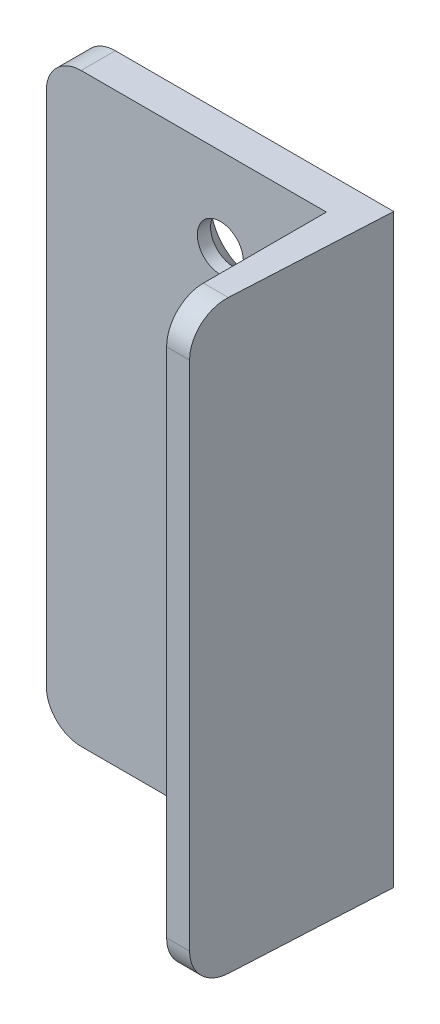
from build123d import *

# Parameters (mm, degrees)
BOSS_EXTRUDE1_DEPTH                            = 4.9
SKETCH2_W                                      = 4.75
SKETCH2_H                                      = 83.9
BOSS_EXTRUDE2_DEPTH                            = 22.9
CUT_EXTRUDE1_START                             = -4.75
CUT_EXTRUDE1_DEPTH                             = 4.75
CSK_FOR_M6_FLAT_HEAD_MACHINE_SCREW1_AT_2_COUNT = 2
CSK_FOR_M6_FLAT_HEAD_MACHINE_SCREW1_AT_2_PITCH = 59.791303716
SKETCH8_W                                      = 41.834673512
SKETCH8_H                                      = 83.9
CUT_REVOLVE4_ANGLE                             = 3


# Read off the part's stored shape, not the designer's step: Cut-Extrude1
with BuildPart() as part:
    # Sketch1 → Boss-Extrude1 (new body)
    with BuildSketch(Plane.XY):
        with BuildLine():
            Line((-17.45, -41.95), (22.45, -41.95))
            Line((22.45, -41.95), (22.45, 41.95))
            Line((22.45, 41.95), (-17.45, 41.95))
            ThreePointArc((-17.45, 41.95), (-20.985533906, 40.485533906), (-22.45, 36.95))
            Line((-22.45, 36.95), (-22.45, -36.95))
            ThreePointArc((-22.45, -36.95), (-20.985533906, -40.485533906), (-17.45, -41.95))
        make_face()
    extrude(amount=BOSS_EXTRUDE1_DEPTH)

    # Sketch2 → Boss-Extrude2 (add)
    with BuildSketch(Plane.XY.offset(4.9)):
        with Locations((20.075, 0)):
            Rectangle(SKETCH2_W, SKETCH2_H)
    extrude(amount=BOSS_EXTRUDE2_DEPTH)

    # Cut-Extrude1 outline → Cut-Extrude1 (cut)
    with BuildSketch(Plane(origin=(22.45, 0, 0), x_dir=(0, 0, -1), z_dir=(1, 0, 0)).offset(CUT_EXTRUDE1_START)):
        with BuildLine():
            Line((-27.8, 41.95), (-27.800002133, 36.67650399))
            ThreePointArc((-27.800002133, 36.67650399), (-26.255432728, 40.405429091), (-22.526508249, 41.95))
            Line((-22.526508249, 41.95), (-27.8, 41.95))
        make_face()
        with BuildLine():
            Line((-27.8, -36.676506119), (-27.8, -41.95))
            Line((-27.8, -41.95), (-22.526505934, -41.95))
            ThreePointArc((-22.526505934, -41.95), (-26.255429337, -40.405429468), (-27.8, -36.676506119))
        make_face()
    extrude(amount=CUT_EXTRUDE1_DEPTH, mode=Mode.SUBTRACT)

    # Sketch6 → CSK for M6 Flat Head Machine Screw1 (revolve, cut)
    with BuildSketch(Plane(origin=(2.5, 29.895651858, 0), x_dir=(0, 1, 0), z_dir=(1, 0, 0))):
        Polygon((0, 0), (0, 4.9), (3.3, 4.9), (3.3, 3), (6.3, 0), align=None)
    csk_for_m6_flat_head_machine_screw1 = revolve(axis=Axis((2.5, 29.895651858, -6.35), (0, 0, 1)), mode=Mode.SUBTRACT)

    # CSK for M6 Flat Head Machine Screw1 at 2: CSK for M6 Flat Head Machine Screw1 ×2
    with Locations(*[(0, -i * CSK_FOR_M6_FLAT_HEAD_MACHINE_SCREW1_AT_2_PITCH, 0) for i in range(1, CSK_FOR_M6_FLAT_HEAD_MACHINE_SCREW1_AT_2_COUNT)]):
        add(csk_for_m6_flat_head_machine_screw1, mode=Mode.SUBTRACT)

    # Sketch8 → Cut-Revolve4 (revolve, cut)
    with BuildSketch(Plane(origin=(22.45, 0, 0), x_dir=(0, 0, -1), z_dir=(1, 0, 0))):
        with Locations((-20.917336756, 0)):
            Rectangle(SKETCH8_W, SKETCH8_H)
    revolve(axis=Axis((22.45, -41.95, 0), (0, -1, 0)), revolution_arc=CUT_REVOLVE4_ANGLE, mode=Mode.SUBTRACT)


solid = part.part
